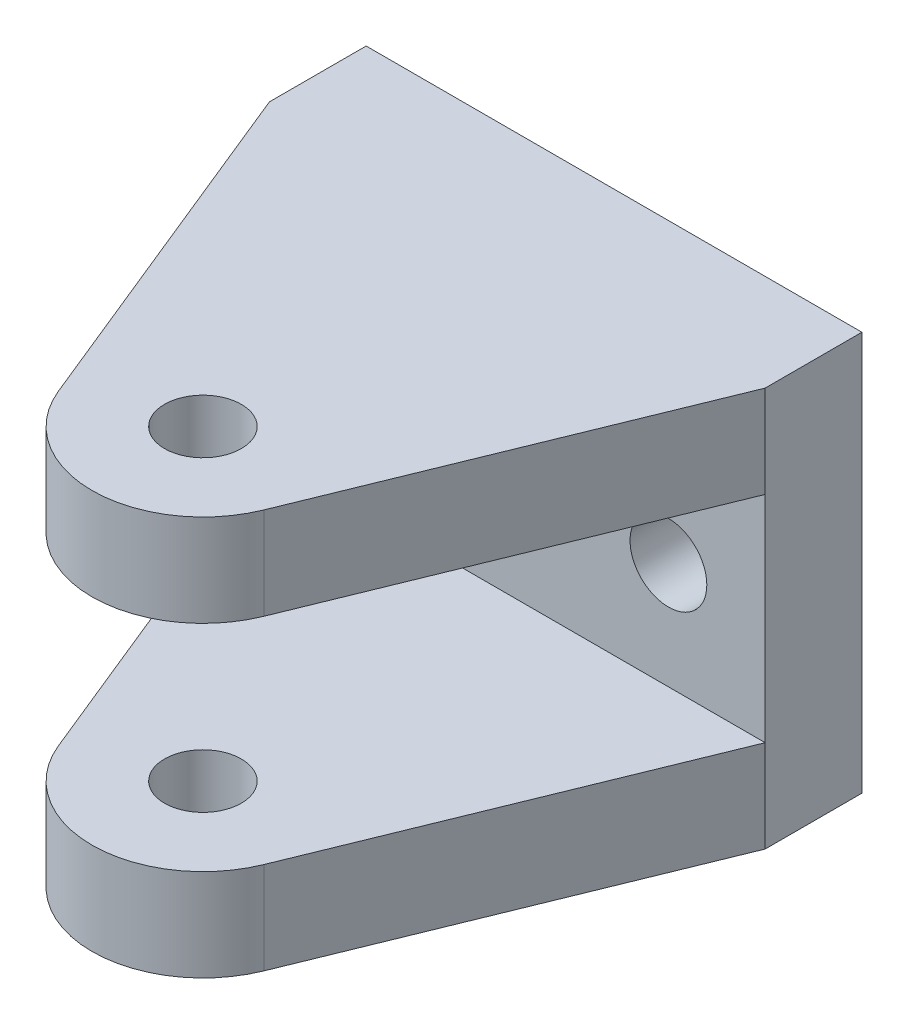
from build123d import *

# Parameters (mm, degrees)
SKETCH1_W                      = 41
SKETCH1_H                      = 33.02
SKETCH1_R                      = 3.175
BOSS_EXTRUDE1_DEPTH            = 8
SKETCH2_W                      = 41
SKETCH2_H                      = 7.62
BOSS_EXTRUDE2_DEPTH            = 53
CUT_EXTRUDE1_REACH             = 68.437
SKETCH4_R                      = 3.175
CUT_EXTRUDE1_DIRECTION_2_REACH = 68.437
CUT_EXTRUDE2_REACH             = 68.437
CUT_EXTRUDE2_DIRECTION_2_REACH = 68.437


with BuildPart() as part:
    # Sketch1 → Boss-Extrude1 (new body)
    with BuildSketch(Plane.XY):
        Rectangle(SKETCH1_W, SKETCH1_H)
        with Locations((12.5, 0)):
            Circle(SKETCH1_R, mode=Mode.SUBTRACT)
        with Locations((-12.5, 0)):
            Circle(SKETCH1_R, mode=Mode.SUBTRACT)
    extrude(amount=BOSS_EXTRUDE1_DEPTH)

    # Sketch2 → Boss-Extrude2 (add)
    with BuildSketch(Plane.XY.offset(8)):
        with Locations((0, 12.7)):
            Rectangle(SKETCH2_W, SKETCH2_H)
        with Locations((0, -12.7)):
            Rectangle(SKETCH2_W, SKETCH2_H)
    extrude(amount=BOSS_EXTRUDE2_DEPTH)

    # Cut-Extrude1: up to this face of the body (flat: up to its plane)
    cut_extrude1_end = Plane(part.part.faces().sort_by_distance((0, -16.51, 30.5))[0])
    # Sketch4 → Cut-Extrude1 (cut, up to the picked face)
    with BuildSketch(Plane(origin=(0, 0, 0), x_dir=(1, 0, 0), z_dir=(0, 1, 0)), mode=Mode.PRIVATE) as cut_extrude1_sk1:
        with Locations((0, -34)):
            Circle(SKETCH4_R)
    cut_extrude1_tool1 = split(extrude(cut_extrude1_sk1.sketch, amount=-CUT_EXTRUDE1_REACH, mode=Mode.PRIVATE), bisect_by=cut_extrude1_end, keep=Keep.BOTH, mode=Mode.PRIVATE)
    add(cut_extrude1_tool1.solids().sort_by(Axis((0, 0, 34), (0, -1, 0)))[0], mode=Mode.SUBTRACT)

    # Cut-Extrude1 direction 2: up to this face of the body (flat: up to its plane)
    cut_extrude1_direction_2_end = Plane(part.part.faces().sort_by_distance((0, 16.51, 30.5))[0])
    # Sketch4 → Cut-Extrude1 direction 2 (cut, up to the picked face)
    with BuildSketch(Plane(origin=(0, 0, 0), x_dir=(1, 0, 0), z_dir=(0, 1, 0)), mode=Mode.PRIVATE) as cut_extrude1_direction_2_sk1:
        with Locations((0, -34)):
            Circle(SKETCH4_R)
    cut_extrude1_direction_2_tool1 = split(extrude(cut_extrude1_direction_2_sk1.sketch, amount=CUT_EXTRUDE1_DIRECTION_2_REACH, mode=Mode.PRIVATE), bisect_by=cut_extrude1_direction_2_end, keep=Keep.BOTH, mode=Mode.PRIVATE)
    add(cut_extrude1_direction_2_tool1.solids().sort_by(Axis((0, 0, 34), (0, 1, 0)))[0], mode=Mode.SUBTRACT)

    # Cut-Extrude2: up to this face of the body (flat: up to its plane)
    cut_extrude2_end = Plane(part.part.faces().sort_by_distance((0, -16.51, 30.455112429))[0])
    # Sketch5 → Cut-Extrude2 (cut, up to the picked face)
    with BuildSketch(Plane(origin=(0, 0, 0), x_dir=(1, 0, 0), z_dir=(0, 1, 0)), mode=Mode.PRIVATE) as cut_extrude2_sk1:
        with BuildLine():
            Line((20.5, -61), (20.5, -8))
            Line((20.5, -8), (8.496878434, -37.461745496))
            ThreePointArc((8.496878434, -37.461745496), (0, -43.175), (-8.496878434, -37.461745496))
            Line((-8.496878434, -37.461745496), (-20.5, -8))
            Line((-20.5, -8), (-20.5, -61))
            Line((-20.5, -61), (20.5, -61))
        make_face()
    cut_extrude2_tool1 = split(extrude(cut_extrude2_sk1.sketch, amount=-CUT_EXTRUDE2_REACH, mode=Mode.PRIVATE), bisect_by=cut_extrude2_end, keep=Keep.BOTH, mode=Mode.PRIVATE)
    add(cut_extrude2_tool1.solids().sort_by(Axis((0, 0, 43.644879), (0, -1, 0)))[0], mode=Mode.SUBTRACT)

    # Cut-Extrude2 direction 2: up to this face of the body (flat: up to its plane)
    cut_extrude2_direction_2_end = Plane(part.part.faces().sort_by_distance((0, 16.51, 30.455112429))[0])
    # Sketch5 → Cut-Extrude2 direction 2 (cut, up to the picked face)
    with BuildSketch(Plane(origin=(0, 0, 0), x_dir=(1, 0, 0), z_dir=(0, 1, 0)), mode=Mode.PRIVATE) as cut_extrude2_direction_2_sk1:
        with BuildLine():
            Line((20.5, -61), (20.5, -8))
            Line((20.5, -8), (8.496878434, -37.461745496))
            ThreePointArc((8.496878434, -37.461745496), (0, -43.175), (-8.496878434, -37.461745496))
            Line((-8.496878434, -37.461745496), (-20.5, -8))
            Line((-20.5, -8), (-20.5, -61))
            Line((-20.5, -61), (20.5, -61))
        make_face()
    cut_extrude2_direction_2_tool1 = split(extrude(cut_extrude2_direction_2_sk1.sketch, amount=CUT_EXTRUDE2_DIRECTION_2_REACH, mode=Mode.PRIVATE), bisect_by=cut_extrude2_direction_2_end, keep=Keep.BOTH, mode=Mode.PRIVATE)
    add(cut_extrude2_direction_2_tool1.solids().sort_by(Axis((0, 0, 43.644879), (0, 1, 0)))[0], mode=Mode.SUBTRACT)


solid = part.part
